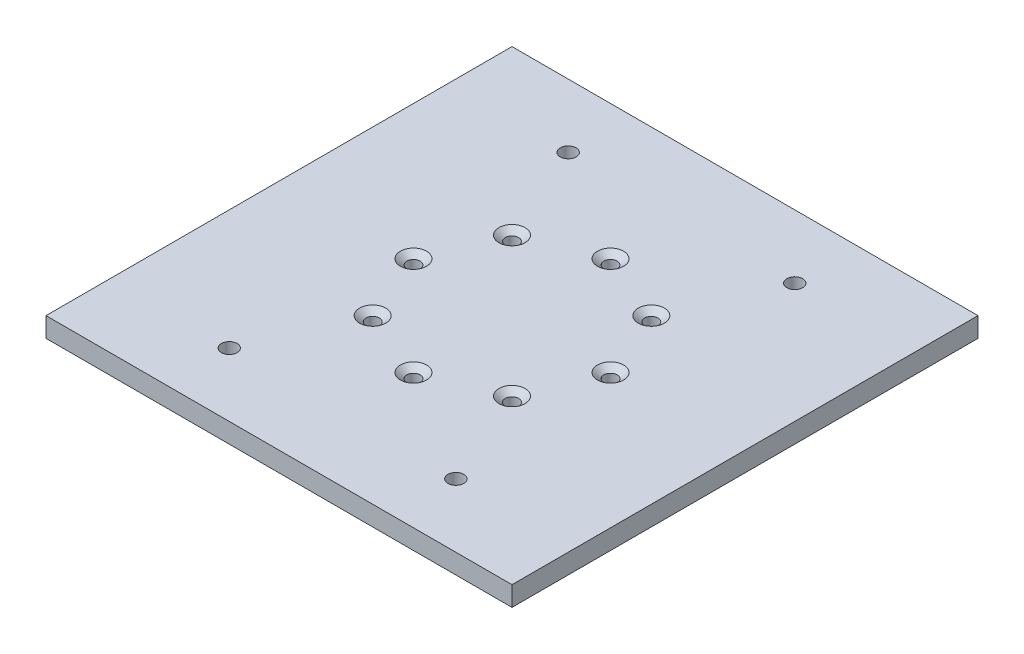
from build123d import *

# Parameters (mm, degrees)
SKETCH1_W                                         = 150.1775
SKETCH1_H                                         = 150.1775
BOSS_EXTRUDE1_DEPTH                               = 6.35
F_7_0_201_DIAMETER_HOLE1_D                        = 5.1054
CIRPATTERN1_COUNT                                 = 2
CSK_FOR_8_FLAT_HEAD_MACHINE_SCREW_100_D           = 4.3053
CSK_FOR_8_FLAT_HEAD_MACHINE_SCREW_100_CSINK_D     = 8.4328
CSK_FOR_8_FLAT_HEAD_MACHINE_SCREW_100_CSINK_ANGLE = 100
CIRPATTERN2_COUNT                                 = 8


with BuildPart() as part:
    # Sketch1 → Boss-Extrude1 (new body)
    with BuildSketch(Plane(origin=(0, 0, 0), x_dir=(1, 0, 0), z_dir=(0, 1, 0))):
        Rectangle(SKETCH1_W, SKETCH1_H)
    extrude(amount=BOSS_EXTRUDE1_DEPTH)

    # #7 (0.201) Diameter Hole1 (through all)
    with Locations(Plane(origin=(0, 6.35, 0), x_dir=(-1, 0, 0), z_dir=(0, 1, 0))):
        with Locations((36.5125, -54.61), (-36.5125, -54.61)):
            f_7_0_201_diameter_hole1 = Hole(F_7_0_201_DIAMETER_HOLE1_D / 2)

    # CirPattern1: #7 (0.201) Diameter Hole1 ×2 about axis
    cirpattern1_axis = Axis((0, 0, 0), (0, 1, 0))
    for i in range(1, CIRPATTERN1_COUNT):
        add(f_7_0_201_diameter_hole1.rotate(cirpattern1_axis, i * 360 / CIRPATTERN1_COUNT), mode=Mode.SUBTRACT)

    # CSK for #8 Flat Head Machine Screw (100)1 (through all)
    with Locations(Plane(origin=(0, 6.35, 0), x_dir=(-1, 0, 0), z_dir=(0, 1, 0))):
        with Locations((0, 31.75)):
            csk_for_8_flat_head_machine_screw_100 = CounterSinkHole(CSK_FOR_8_FLAT_HEAD_MACHINE_SCREW_100_D / 2, CSK_FOR_8_FLAT_HEAD_MACHINE_SCREW_100_CSINK_D / 2, counter_sink_angle=CSK_FOR_8_FLAT_HEAD_MACHINE_SCREW_100_CSINK_ANGLE)

    # CirPattern2: CSK for #8 Flat Head Machine Screw (100)1 ×8 about axis
    cirpattern2_axis = Axis((0, 0, 0), (0, 1, 0))
    for i in range(1, CIRPATTERN2_COUNT):
        add(csk_for_8_flat_head_machine_screw_100.rotate(cirpattern2_axis, i * 360 / CIRPATTERN2_COUNT), mode=Mode.SUBTRACT)


solid = part.part
